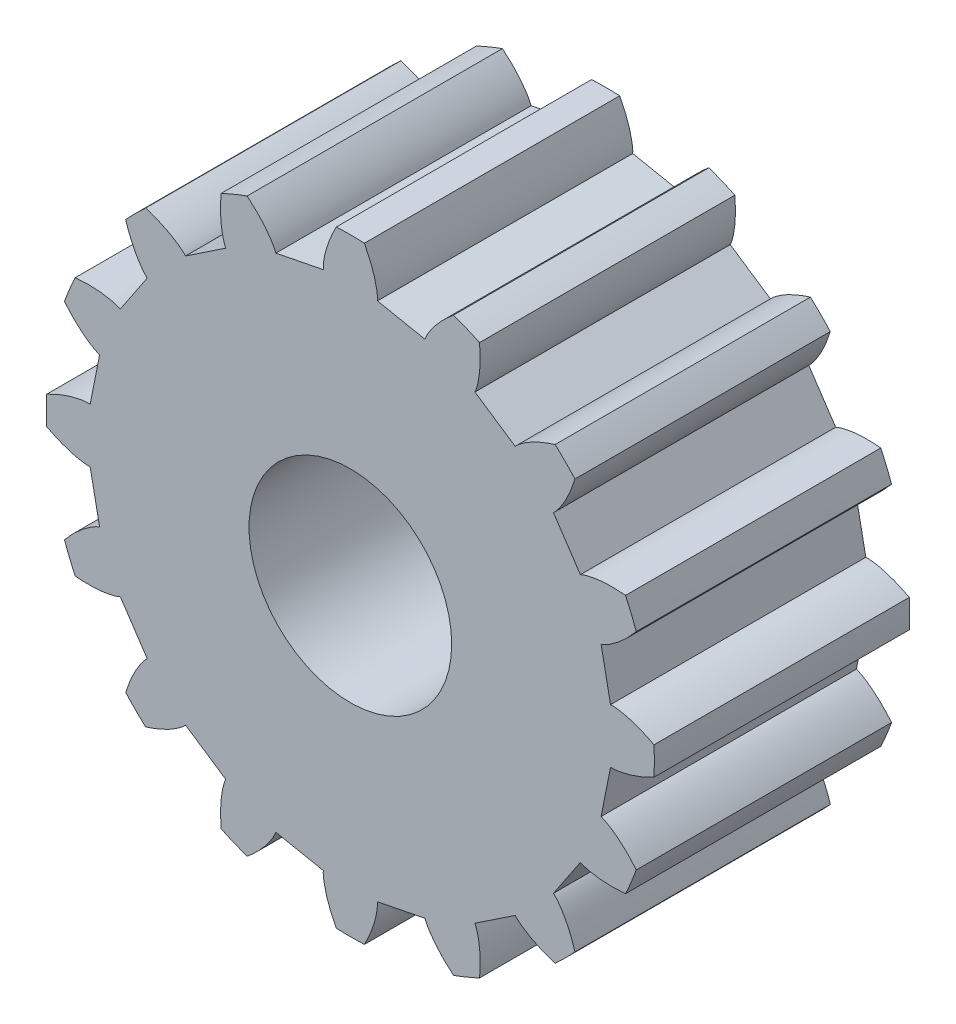
from build123d import *

# Parameters (mm, degrees)
SKETCH1_R               = 14.2875
BOSS_EXTRUDE1_DEPTH     = 12
CUT_EXTRUDE2_DEPTH      = 13
CIRPATTERN1_COUNT       = 16
CUT_EXTRUDE4_DEPTH      = 14
CUT_EXTRUDE4_DEPTH_BACK = 14
SKETCH3_R               = 4.7625


with BuildPart() as part:
    # Sketch1 → Boss-Extrude1 (new body)
    with BuildSketch(Plane.XY):
        Circle(SKETCH1_R)
    extrude(amount=BOSS_EXTRUDE1_DEPTH)

    # Sketch2 → Cut-Extrude2 (cut, symmetric)
    with BuildSketch(Plane.XY):
        with BuildLine():
            add(Edge.make_bspline(
                [(12.229398428, 1.272996615), (12.232569464, 1.273286616), (12.24147496, 1.27397705), (12.258355017, 1.274796659), (12.285950585, 1.275443331), (12.321178928, 1.275251476), (12.366773102, 1.273836189), (12.420546418, 1.270667153), (12.479687741, 1.26561074), (12.544059737, 1.258411302), (12.608289269, 1.249727247), (12.672354395, 1.239667418), (12.736156846, 1.228386466), (12.813405758, 1.213233983), (12.905973255, 1.192997232), (13.01403689, 1.166335588), (13.136405998, 1.132550383), (13.260856391, 1.094333587), (13.383078241, 1.05362131), (13.506236131, 1.00892567), (13.625159484, 0.963157367), (13.74827665, 0.911985231), (13.861717136, 0.862901529), (13.98829551, 0.803906078), (14.090299927, 0.755125575), (14.195197101, 0.701408819), (14.246179434, 0.67477432), (14.272203516, 0.660956172)],
                knots=[0, 0, 0, 0, 0, 0.005376749, 0.015083688, 0.02853182, 0.04661014, 0.064854849, 0.092110526, 0.119476176, 0.146842496, 0.174208854, 0.201574956, 0.228941013, 0.256307345, 0.307035032, 0.361767352, 0.416499661, 0.471231937, 0.525964282, 0.580696616, 0.635428982, 0.690161387, 0.744893688, 0.799626082, 0.854358407, 0.909090914, 0.909090914, 0.909090914, 0.909090914, 0.909090914], degree=4))
            Line((14.272203516, 0.660956172), (59.935762795, 2.775668965))
            add(Edge.make_bspline(
                [(59.935762795, 2.775668965), (59.931630356, 2.864901825), (59.922571104, 3.049480891), (59.902165694, 3.440419569), (59.877579242, 3.838864849), (59.840808515, 4.384473066), (59.791455691, 5.01973039), (59.724470289, 5.770803476), (59.636018849, 6.621628164), (59.535214074, 7.474533703), (59.422361052, 8.323878311), (59.297279712, 9.17280178), (59.160175965, 10.018977678), (59.010873176, 10.863801486), (58.849682784, 11.705714261), (58.676209407, 12.546100116), (58.491172453, 13.382667924), (58.293497058, 14.218465783), (58.085046948, 15.048188716), (57.862866002, 15.880024995), (57.631950551, 16.700058452), (57.384099029, 17.530991619), (57.133463512, 18.333578353), (56.889087073, 19.073728923), (56.697889707, 19.634977834), (56.527852443, 20.11504821), (56.4659571, 20.288017853), (56.435627038, 20.372039682)],
                knots=[0.083333333, 0.083333333, 0.083333333, 0.083333333, 0.083333333, 0.103174603, 0.123015873, 0.142857143, 0.162698412, 0.202380952, 0.242063492, 0.281746032, 0.321428571, 0.361111111, 0.400793651, 0.44047619, 0.48015873, 0.51984127, 0.55952381, 0.599206349, 0.638888889, 0.678571429, 0.718253968, 0.757936508, 0.797619048, 0.837301588, 0.876984127, 0.896825397, 0.916666667, 0.916666667, 0.916666667, 0.916666667, 0.916666667], degree=4))
            Line((56.435627038, 20.372039682), (13.438733689, 4.851091949))
            add(Edge.make_bspline(
                [(11.785645616, 3.503892648), (11.78868625, 3.504838225), (11.797178074, 3.507608333), (11.813086863, 3.513310832), (11.838829315, 3.523273751), (11.87130264, 3.536932305), (11.912884557, 3.555687995), (11.961351885, 3.579193959), (12.014056338, 3.606497881), (12.070773202, 3.63778339), (12.126790307, 3.670385988), (12.182129036, 3.704196722), (12.236757782, 3.739035103), (12.302327866, 3.78259605), (12.380104813, 3.836716418), (12.469739624, 3.902702728), (12.5698649, 3.980744818), (12.670217137, 4.063677637), (12.767555488, 4.148063154), (12.864234261, 4.236487024), (12.956590341, 4.324281419), (13.050753042, 4.418673208), (13.136774866, 4.507432431), (13.231141453, 4.610376567), (13.306713757, 4.694479276), (13.383069595, 4.784249498), (13.419978548, 4.82836666), (13.438733689, 4.851091949)],
                knots=[0, 0, 0, 0, 0, 0.005376749, 0.015083688, 0.02853182, 0.04661014, 0.064854849, 0.092110526, 0.119476176, 0.146842496, 0.174208854, 0.201574956, 0.228941013, 0.256307345, 0.307035032, 0.361767352, 0.416499661, 0.471231937, 0.525964282, 0.580696616, 0.635428982, 0.690161387, 0.744893688, 0.799626082, 0.854358407, 0.909090915, 0.909090915, 0.909090915, 0.909090915, 0.909090915], degree=4))
            Line((11.785645616, 3.503892648), (12.229398428, 1.272996615))
        make_face()
    cut_extrude2 = extrude(amount=CUT_EXTRUDE2_DEPTH, both=True, mode=Mode.SUBTRACT)

    # CirPattern1: Cut-Extrude2 ×16 about axis
    cirpattern1_axis = Axis((0, 0, -0.6), (0, 0, 1))
    for i in range(1, CIRPATTERN1_COUNT):
        add(cut_extrude2.rotate(cirpattern1_axis, i * 360 / CIRPATTERN1_COUNT), mode=Mode.SUBTRACT)

    # Sketch3 → Cut-Extrude4 (cut, two sides: drawn at the far end of the back side and taken through both)
    with BuildSketch(Plane.XY.offset(-CUT_EXTRUDE4_DEPTH_BACK)):
        Circle(SKETCH3_R)
    extrude(amount=CUT_EXTRUDE4_DEPTH + CUT_EXTRUDE4_DEPTH_BACK, mode=Mode.SUBTRACT)


solid = part.part
